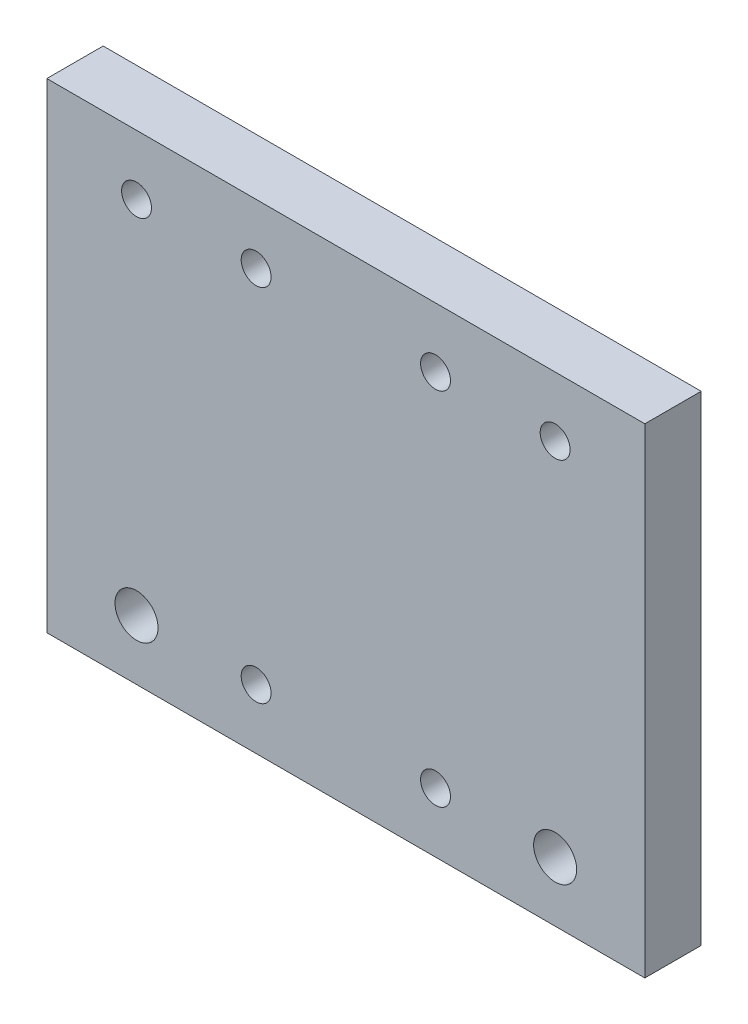
from build123d import *

# Parameters (mm, degrees)
SKETCH1_W           = 100
SKETCH1_H           = 80.26
SKETCH1_R           = 3.6
SKETCH1_R_2         = 2.5
BOSS_EXTRUDE1_DEPTH = 9.42
SKETCH2_R           = 2.5
CUT_EXTRUDE1_DEPTH  = 117.86751842


with BuildPart() as part:
    # Sketch1 → Boss-Extrude1 (new body)
    with BuildSketch(Plane.XY):
        with Locations((52.710746881, 14.822551686)):
            Rectangle(SKETCH1_W, SKETCH1_H)
        with Locations((17.710746881, -15.307448314)):
            Circle(SKETCH1_R, mode=Mode.SUBTRACT)
        with Locations((17.710746881, 44.952551686)):
            Circle(SKETCH1_R_2, mode=Mode.SUBTRACT)
        with Locations((87.710746881, 44.952551686)):
            Circle(SKETCH1_R_2, mode=Mode.SUBTRACT)
        with Locations((87.710746881, -15.307448314)):
            Circle(SKETCH1_R, mode=Mode.SUBTRACT)
    extrude(amount=BOSS_EXTRUDE1_DEPTH)

    # Sketch2 → Cut-Extrude1 (cut, through all)
    with BuildSketch(Plane.XY.offset(9.42)):
        with Locations((37.710746881, -15.307448314)):
            Circle(SKETCH2_R)
        with Locations((67.710746881, -15.307448314)):
            Circle(SKETCH2_R)
        with Locations((67.710746881, 44.952551686)):
            Circle(SKETCH2_R)
        with Locations((37.710746881, 44.952551686)):
            Circle(SKETCH2_R)
    extrude(amount=-CUT_EXTRUDE1_DEPTH, mode=Mode.SUBTRACT)


solid = part.part
